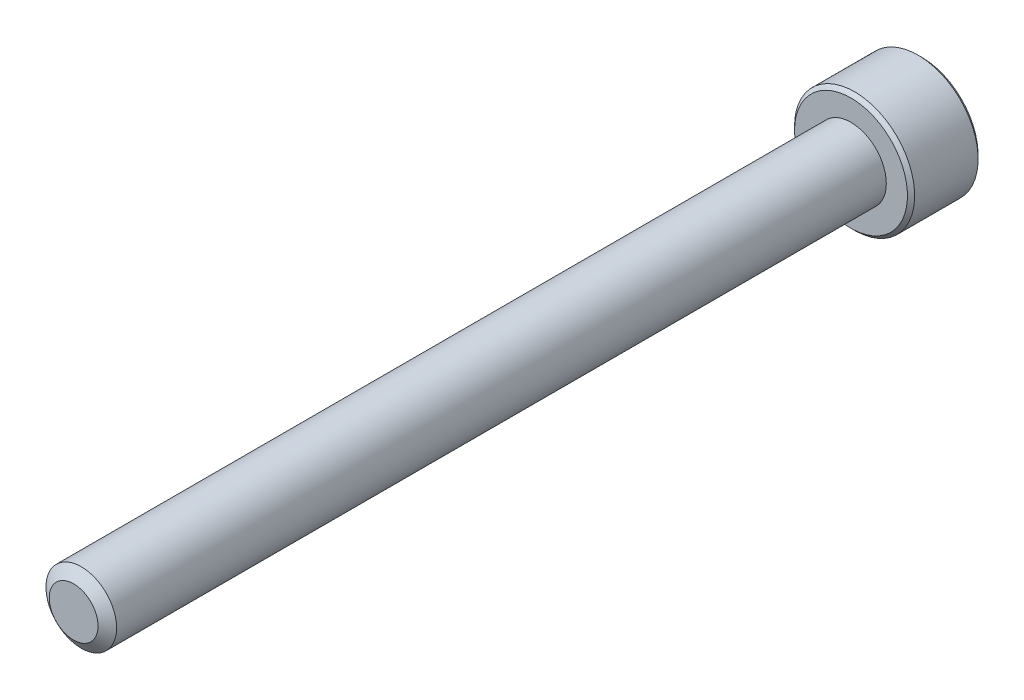
from build123d import *

# Parameters (mm, degrees)
SKETCH1_R          = 2.5
EXTRUDE1_DEPTH     = 55
SKETCH6_R          = 4.25
EXTRUDE2_DEPTH     = 5
CUT_EXTRUDE1_DEPTH = 3
CHAMFER1_SIZE      = 0.255


with BuildPart() as part:
    # Sketch1 → Extrude1 (new body)
    with BuildSketch(Plane.XY):
        Circle(SKETCH1_R)
    extrude(amount=-EXTRUDE1_DEPTH)

    # Sketch4 → Cut-Revolve1 (revolve, cut)
    with BuildSketch(Plane(origin=(0, 0, 0), x_dir=(0, 0, -1), z_dir=(1, 0, 0))):
        Polygon((0.541691224, 2.5), (0, 1.726384758), (0, 2.5), align=None)
    revolve(axis=Axis((0, 0, 0), (0, 0, -1)), mode=Mode.SUBTRACT)

    # Sketch6 → Extrude2 (add)
    with BuildSketch(Plane(origin=(0, 0, -55), x_dir=(-1, 0, 0), z_dir=(0, 0, -1))):
        Circle(SKETCH6_R)
    extrude(amount=EXTRUDE2_DEPTH)

    # Sketch7 → Cut-Extrude1 (cut)
    with BuildSketch(Plane(origin=(0, 0, -60), x_dir=(-1, 0, 0), z_dir=(0, 0, -1))):
        Polygon((0, 2.309401077), (-2, 1.154700538), (-2, -1.154700538), (0, -2.309401077), (2, -1.154700538), (2, 1.154700538), align=None)
    extrude(amount=-CUT_EXTRUDE1_DEPTH, mode=Mode.SUBTRACT)

    # Cut-Extrude2 cone 1 section (through the dimple's axis) → Cut-Extrude2 (revolve, cut)
    with BuildSketch(Plane(origin=(0, 0, -60), x_dir=(0, 1, 0), z_dir=(1, 0, 0))):
        Polygon((0, 0), (2.309401077, 0), (0, 2.309401077), align=None)
    revolve(axis=Axis((0, 0, -60), (0, 0, 1)), mode=Mode.SUBTRACT)

    # Chamfer1
    chamfer1_edges = [part.edges().sort_by_distance(p)[0] for p in [
        (4.25, 0, -60),
        (4.25, 0, -55),
    ]]
    chamfer(chamfer1_edges, length=CHAMFER1_SIZE)

    # Sketch10 → Revolve1 (revolve)
    with BuildSketch(Plane(origin=(0, 0, 0), x_dir=(0, 0, -1), z_dir=(1, 0, 0))):
        Polygon((55, 2.5), (55, 0), (53.764466094, 0), (54.8, 2.5), align=None)
    revolve(axis=Axis((0, 0, -55), (0, 0, 1)))


solid = part.part
